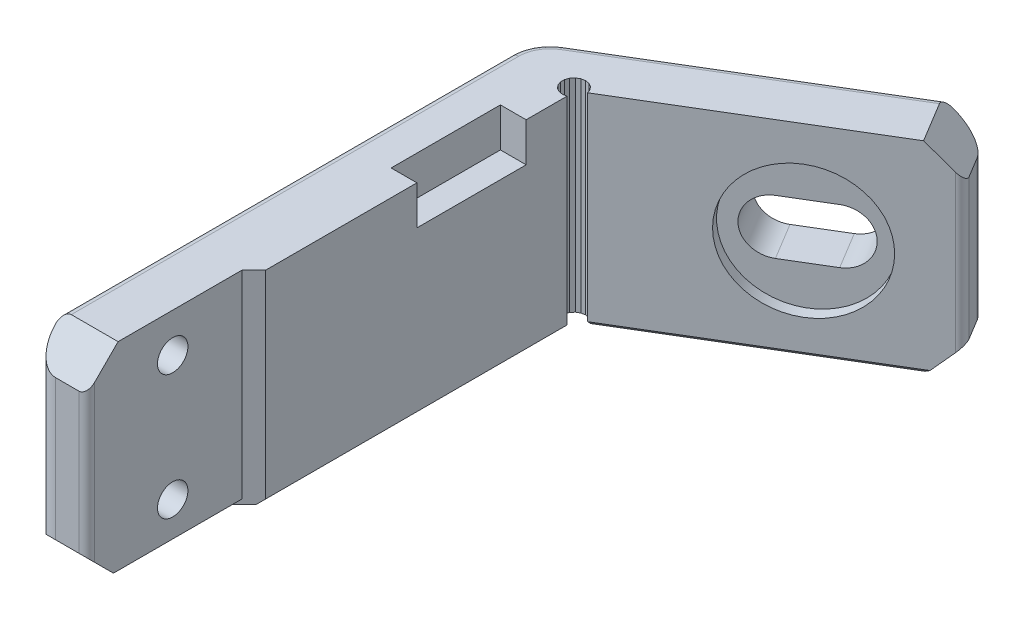
from build123d import *

# Parameters (mm, degrees)
LEG_AND_PAD_DEPTH          = 13
SCREW_HEAD_RELIEF_SKETCH_W = 14
SCREW_HEAD_RELIEF_SKETCH_H = 6
SCREW_HEAD_RELIEF_DEPTH    = 2.35
M6_SLOT_MIDDLE_DEPTH       = 3.5
SCREW_HOLES_SKETCH_R       = 1.95
SCREW_HOLES_DEPTH          = 4.5
LEG_TOP_CORNERS_SIZE       = 4
PAD_END_CORNERS_SIZE       = 4
OUTSIDE_OF_THE_BEND_R      = 5
LEG_TOP_OUTER_EDGE_R       = 3
PAD_END_OUTER_EDGE_R       = 3
LEG_TOP_INNER_EDGE_R       = 1
PAD_END_INNER_EDGE_R       = 1
BED_FACE_CHAMFER_SIZE      = 0.6
TOP_FACE_EDGE_R            = 1


with BuildPart() as part:
    # leg and pad sketch → leg and pad (new, symmetric)
    with BuildSketch(Plane(origin=(0, -20.7, 0), x_dir=(1, 0, 0), z_dir=(0, 1, 0))):
        Polygon((0.551289683, 30.332713936), (0.367250577, 30.819395741), (0.028023026, 31.213926146), (-0.425575667, 31.468833575), (-0.938966578, 31.553446481), (-1.450376329, 31.457583879), (-1.898269923, 31.192780366), (-2.228754897, 30.790898227), (-2.402065893, 30.30029363), (-2.397349395, 29.779998208), (-2.215172912, 29.292616119), (-1.877456693, 28.896791249), (-1.424836191, 28.640150931), (-0.91177263, 28.55357522), (-0.4, 28.647481273), (-0.4, -9.98), (-1.92, -11.5), (-1.92, -31.37), (-8.92, -31.37), (-8.92, 32.792642706), (27.204821487, 54.594667874), (30.821788068, 48.601542416), align=None)
    extrude(amount=LEG_AND_PAD_DEPTH, both=True)

    # screw head relief sketch → screw head relief (cut, symmetric)
    with BuildSketch(Plane(origin=(-1.35, 0, 0), x_dir=(0, 0, -1), z_dir=(1, 0, 0))):
        with Locations((16.4, -9.7)):
            Rectangle(SCREW_HEAD_RELIEF_SKETCH_W, SCREW_HEAD_RELIEF_SKETCH_H)
    extrude(amount=SCREW_HEAD_RELIEF_DEPTH, both=True, mode=Mode.SUBTRACT)

    # insert flange relief sketch → insert flange relief (revolve, cut)
    with BuildSketch(Plane(origin=(0, -20.7, 0), x_dir=(1, 0, 0), z_dir=(0, 1, 0))):
        Polygon((18.324853729, 39.891397061), (17.03307995, 42.03179901), (9.755713323, 37.639768162), (11.047487102, 35.499366213), align=None)
    revolve(axis=Axis((18.324853729, -20.7, -39.891397061), (-0.5167095115681243, 0, -0.8561607796757748)), mode=Mode.SUBTRACT)

    # M6 slot end 1 sketch → M6 slot end 1 (revolve, cut)
    with BuildSketch(Plane(origin=(0, -20.7, 0), x_dir=(1, 0, 0), z_dir=(0, 1, 0))):
        Polygon((20.893336068, 41.441525596), (16.242950464, 49.146972613), (13.246387735, 47.338489322), (17.896773339, 39.633042305), align=None)
    revolve(axis=Axis((20.893336068, -20.7, -41.441525596), (-0.5167095115681233, 0, -0.8561607796757753)), mode=Mode.SUBTRACT)

    # M6 slot end 2 sketch → M6 slot end 2 (revolve, cut)
    with BuildSketch(Plane(origin=(0, -20.7, 0), x_dir=(1, 0, 0), z_dir=(0, 1, 0))):
        Polygon((15.75637139, 38.341268526), (11.105985786, 46.046715543), (8.109423057, 44.238232253), (12.759808661, 36.532785236), align=None)
    revolve(axis=Axis((15.75637139, -20.7, -38.341268526), (-0.5167095115681234, 0, -0.8561607796757752)), mode=Mode.SUBTRACT)

    # M6 slot middle sketch → M6 slot middle (cut, symmetric)
    with BuildSketch(Plane(origin=(0, -20.7, 0), x_dir=(1, 0, 0), z_dir=(0, 1, 0))):
        Polygon((15.75637139, 38.341268526), (20.893336068, 41.441525596), (16.242950464, 49.146972613), (11.105985786, 46.046715543), align=None)
    extrude(amount=M6_SLOT_MIDDLE_DEPTH, both=True, mode=Mode.SUBTRACT)

    # screw holes sketch → screw holes (cut, symmetric)
    with BuildSketch(Plane(origin=(-5.42, 0, 0), x_dir=(0, 0, -1), z_dir=(1, 0, 0))):
        with Locations((-20.375, -28.7)):
            Circle(SCREW_HOLES_SKETCH_R)
        with Locations((-20.375, -12.7)):
            Circle(SCREW_HOLES_SKETCH_R)
    extrude(amount=SCREW_HOLES_DEPTH, both=True, mode=Mode.SUBTRACT)

    # leg top corners
    leg_top_corners_edges = [part.edges().sort_by_distance(p)[0] for p in [
        (-5.42, -7.7, 31.37),
        (-5.42, -33.7, 31.37),
    ]]
    chamfer(leg_top_corners_edges, length=LEG_TOP_CORNERS_SIZE)

    # pad end corners
    pad_end_corners_edges = [part.edges().sort_by_distance(p)[0] for p in [
        (29.013304778, -7.7, -51.598105145),
        (29.013304778, -33.7, -51.598105145),
    ]]
    chamfer(pad_end_corners_edges, length=PAD_END_CORNERS_SIZE)

    # outside of the bend
    outside_of_the_bend_edges = [part.edges().sort_by_distance(p)[0] for p in [
        (-8.92, -20.7, -32.792642706),
    ]]
    fillet(outside_of_the_bend_edges, radius=OUTSIDE_OF_THE_BEND_R)

    # leg top outer edge
    leg_top_outer_edge_edges = [part.edges().sort_by_distance(p)[0] for p in [
        (-8.92, -20.7, 31.37),
    ]]
    fillet(leg_top_outer_edge_edges, radius=LEG_TOP_OUTER_EDGE_R)

    # pad end outer edge
    pad_end_outer_edge_edges = [part.edges().sort_by_distance(p)[0] for p in [
        (27.204821487, -20.7, -54.594667874),
    ]]
    fillet(pad_end_outer_edge_edges, radius=PAD_END_OUTER_EDGE_R)

    # leg top inner edge
    leg_top_inner_edge_edges = [part.edges().sort_by_distance(p)[0] for p in [
        (-1.92, -20.7, 31.37),
    ]]
    fillet(leg_top_inner_edge_edges, radius=LEG_TOP_INNER_EDGE_R)

    # pad end inner edge
    pad_end_inner_edge_edges = [part.edges().sort_by_distance(p)[0] for p in [
        (30.821788068, -20.7, -48.601542416),
    ]]
    fillet(pad_end_inner_edge_edges, radius=PAD_END_INNER_EDGE_R)

    # bed face chamfer
    bed_face_chamfer_edges = [part.edges().sort_by_distance(p)[0] for p in [
        (13.974217317, -33.7, -38.433709153),
        (8.638315405, -33.7, -43.38942405),
        (-1.92, -33.7, 19.435),
        (-0.4, -33.7, -9.333740636),
        (-8.274178326, -33.7, -32.428085628),
        (-8.92, -33.7, -1.300107187),
    ]]
    chamfer(bed_face_chamfer_edges, length=BED_FACE_CHAMFER_SIZE)

    # top face edge
    top_face_edge_edges = [part.edges().sort_by_distance(p)[0] for p in [
        (8.638315405, -7.7, -43.38942405),
        (-8.274178326, -7.7, -32.428085628),
        (-8.92, -7.7, -1.300107187),
    ]]
    fillet(top_face_edge_edges, radius=TOP_FACE_EDGE_R)


solid = part.part
